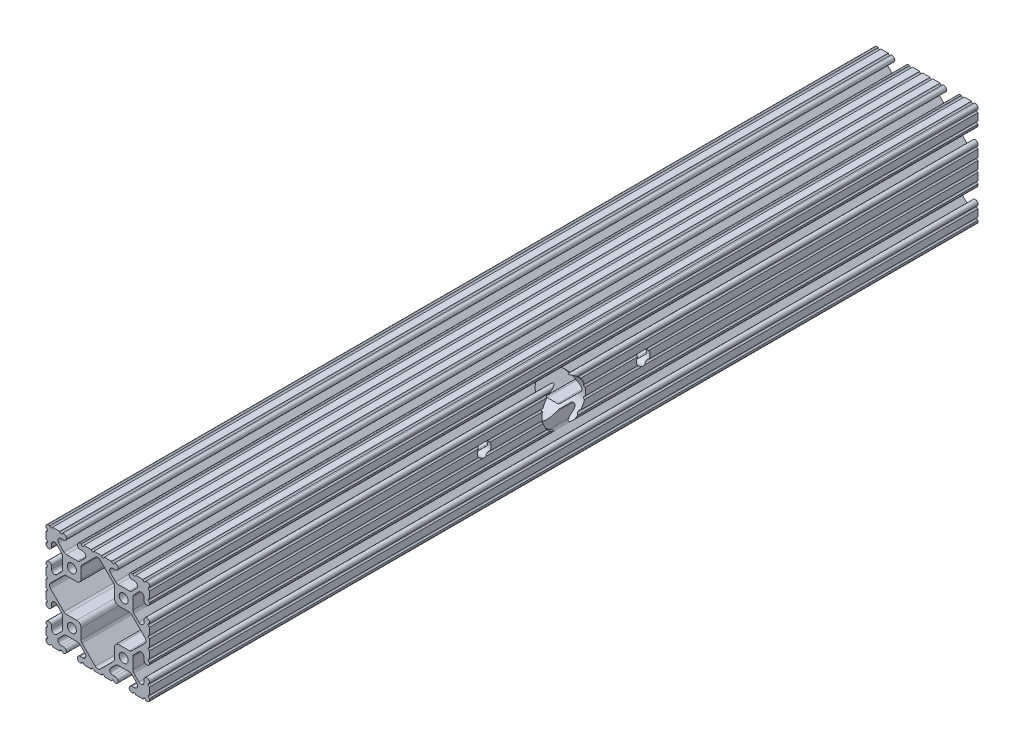
from build123d import *

# Parameters (mm, degrees)
SKETCH3_W               = 38.1
SKETCH3_H               = 38.1
BOSS_EXTRUDE1_DEPTH     = 304.8
SKETCH4_R               = 3.3274
CUT_EXTRUDE1_DEPTH      = 611.195022104
BODY_MOVE_COPY2_START   = -304.8
BODY_MOVE_COPY2_DEPTH   = 609.6
BODY_MOVE_COPY2_2_DEPTH = 609.6
MIRROR1_START           = -304.8
MIRROR1_OUTLINE_R       = 3.3274
MIRROR1_DEPTH           = 609.6
MIRROR5_START           = -304.8
MIRROR5_OUTLINE_R       = 3.3274
MIRROR5_DEPTH           = 609.6
CUT_EXTRUDE2_DEPTH      = 612.9766172
CUT_EXTRUDE3_DEPTH      = 612.9766172
DELETEFACE1_START       = -304.8
DELETEFACE1_DEPTH       = 609.6
FILLET1_R               = 2.54
FILLET2_R               = 1.778
SKETCH8_R               = 16
CUT_EXTRUDE5_DEPTH      = 317.482369177
SKETCH9_R               = 5
CUT_EXTRUDE6_DEPTH      = 317.482369298


# Read off the part's stored shape, not the designer's step: Body-Move/Copy2, Mirror1, Mirror5, DeleteFace1
with BuildPart() as part:
    # Sketch3 → Boss-Extrude1 (new, symmetric)
    with BuildSketch(Plane.XY):
        Rectangle(SKETCH3_W, SKETCH3_H)
    extrude(amount=BOSS_EXTRUDE1_DEPTH, both=True)

    # Sketch4 → Cut-Extrude1 (cut, through all)
    with BuildSketch(Plane.XY.offset(304.8)):
        with BuildLine():
            Line((4.064, 19.05), (-4.064, 19.05))
            Line((-4.064, 19.05), (-4.064, 14.986))
            Line((-4.064, 14.986), (-8.069205235, 14.986))
            ThreePointArc((-8.069205235, 14.986), (-10.118180426, 13.616918548), (-9.637422953, 11.199987518))
            Line((-9.637422953, 11.199987518), (-5.181135435, 6.7437))
            Line((-5.181135435, 6.7437), (5.181135435, 6.7437))
            Line((5.181135435, 6.7437), (9.637422953, 11.199987518))
            ThreePointArc((9.637422953, 11.199987518), (10.118180426, 13.616918548), (8.069205235, 14.986))
            Line((8.069205235, 14.986), (4.064, 14.986))
            Line((4.064, 14.986), (4.064, 19.05))
        make_face()
        with BuildLine():
            Line((19.05, -4.064), (19.05, 4.064))
            Line((19.05, 4.064), (14.986, 4.064))
            Line((14.986, 4.064), (14.986, 8.069205235))
            ThreePointArc((14.986, 8.069205235), (13.616918548, 10.118180426), (11.199987518, 9.637422953))
            Line((11.199987518, 9.637422953), (6.7437, 5.181135435))
            Line((6.7437, 5.181135435), (6.7437, -5.181135435))
            Line((6.7437, -5.181135435), (11.199987518, -9.637422953))
            ThreePointArc((11.199987518, -9.637422953), (13.616918548, -10.118180426), (14.986, -8.069205235))
            Line((14.986, -8.069205235), (14.986, -4.064))
            Line((14.986, -4.064), (19.05, -4.064))
        make_face()
        with BuildLine():
            Line((-4.064, -14.986), (-4.064, -19.05))
            Line((-4.064, -19.05), (4.064, -19.05))
            Line((4.064, -19.05), (4.064, -14.986))
            Line((4.064, -14.986), (8.069205235, -14.986))
            ThreePointArc((8.069205235, -14.986), (10.118180426, -13.616918548), (9.637422953, -11.199987518))
            Line((9.637422953, -11.199987518), (5.181135435, -6.7437))
            Line((5.181135435, -6.7437), (-5.181135435, -6.7437))
            Line((-5.181135435, -6.7437), (-9.637422953, -11.199987518))
            ThreePointArc((-9.637422953, -11.199987518), (-10.118180426, -13.616918548), (-8.069205235, -14.986))
            Line((-8.069205235, -14.986), (-4.064, -14.986))
        make_face()
        with BuildLine():
            Line((-14.986, 4.064), (-19.05, 4.064))
            Line((-19.05, 4.064), (-19.05, -4.064))
            Line((-19.05, -4.064), (-14.986, -4.064))
            Line((-14.986, -4.064), (-14.986, -8.069205235))
            ThreePointArc((-14.986, -8.069205235), (-13.616918548, -10.118180426), (-11.199987518, -9.637422953))
            Line((-11.199987518, -9.637422953), (-6.7437, -5.181135435))
            Line((-6.7437, -5.181135435), (-6.7437, 5.181135435))
            Line((-6.7437, 5.181135435), (-11.199987518, 9.637422953))
            ThreePointArc((-11.199987518, 9.637422953), (-13.616918548, 10.118180426), (-14.986, 8.069205235))
            Line((-14.986, 8.069205235), (-14.986, 4.064))
        make_face()
        Circle(SKETCH4_R)
    extrude(amount=-CUT_EXTRUDE1_DEPTH, mode=Mode.SUBTRACT)

    # Body-Move/Copy2 outline → Body-Move/Copy2 (cut)
    with BuildSketch(Plane.XY.offset(BODY_MOVE_COPY2_START)):
        with BuildLine():
            Line((-13.868864565, 12.3063), (-19.05, 12.3063))
            Line((-19.05, 12.3063), (-19.05, 4.064))
            Line((-19.05, 4.064), (-14.986, 4.064))
            Line((-14.986, 4.064), (-14.986, 8.069205235))
            ThreePointArc((-14.986, 8.069205235), (-13.616918548, 10.118180426), (-11.199987518, 9.637422953))
            Line((-11.199987518, 9.637422953), (-13.868864565, 12.3063))
        make_face()
        with BuildLine():
            Line((-19.05, 19.05), (-19.05, 15.7226))
            ThreePointArc((-19.05, 15.7226), (-16.697172896, 16.697172896), (-15.7226, 19.05))
            Line((-15.7226, 19.05), (-19.05, 19.05))
        make_face()
        with BuildLine():
            Line((-4.064, 19.05), (-12.3063, 19.05))
            Line((-12.3063, 19.05), (-12.3063, 13.868864565))
            Line((-12.3063, 13.868864565), (-9.637422953, 11.199987518))
            ThreePointArc((-9.637422953, 11.199987518), (-10.118180426, 13.616918548), (-8.069205235, 14.986))
            Line((-8.069205235, 14.986), (-4.064, 14.986))
            Line((-4.064, 14.986), (-4.064, 19.05))
        make_face()
        with BuildLine():
            Line((-3.3274, 0), (-6.7437, 0))
            Line((-6.7437, 0), (-6.7437, -5.181135435))
            Line((-6.7437, -5.181135435), (-11.199987518, -9.637422953))
            ThreePointArc((-11.199987518, -9.637422953), (-13.616918548, -10.118180426), (-14.986, -8.069205235))
            Line((-14.986, -8.069205235), (-14.986, -4.064))
            Line((-14.986, -4.064), (-19.05, -4.064))
            Line((-19.05, -4.064), (-19.05, -19.05))
            Line((-19.05, -19.05), (-4.064, -19.05))
            Line((-4.064, -19.05), (-4.064, -14.986))
            Line((-4.064, -14.986), (-8.069205235, -14.986))
            ThreePointArc((-8.069205235, -14.986), (-10.118180426, -13.616918548), (-9.637422953, -11.199987518))
            Line((-9.637422953, -11.199987518), (-5.181135435, -6.7437))
            Line((-5.181135435, -6.7437), (5.181135435, -6.7437))
            Line((5.181135435, -6.7437), (9.637422953, -11.199987518))
            ThreePointArc((9.637422953, -11.199987518), (10.118180426, -13.616918548), (8.069205235, -14.986))
            Line((8.069205235, -14.986), (4.064, -14.986))
            Line((4.064, -14.986), (4.064, -19.05))
            Line((4.064, -19.05), (19.05, -19.05))
            Line((19.05, -19.05), (19.05, -4.064))
            Line((19.05, -4.064), (14.986, -4.064))
            Line((14.986, -4.064), (14.986, -8.069205235))
            ThreePointArc((14.986, -8.069205235), (13.616918548, -10.118180426), (11.199987518, -9.637422953))
            Line((11.199987518, -9.637422953), (6.7437, -5.181135435))
            Line((6.7437, -5.181135435), (6.7437, 5.181135435))
            Line((6.7437, 5.181135435), (11.199987518, 9.637422953))
            ThreePointArc((11.199987518, 9.637422953), (13.616918548, 10.118180426), (14.986, 8.069205235))
            Line((14.986, 8.069205235), (14.986, 4.064))
            Line((14.986, 4.064), (19.05, 4.064))
            Line((19.05, 4.064), (19.05, 19.05))
            Line((19.05, 19.05), (4.064, 19.05))
            Line((4.064, 19.05), (4.064, 14.986))
            Line((4.064, 14.986), (8.069205235, 14.986))
            ThreePointArc((8.069205235, 14.986), (10.118180426, 13.616918548), (9.637422953, 11.199987518))
            Line((9.637422953, 11.199987518), (5.181135435, 6.7437))
            Line((5.181135435, 6.7437), (0, 6.7437))
            Line((0, 6.7437), (0, 3.3274))
            ThreePointArc((0, 3.3274), (2.352827104, -2.352827104), (-3.3274, 0))
        make_face()
    extrude(amount=BODY_MOVE_COPY2_DEPTH, mode=Mode.SUBTRACT)

    # Body-Move_Copy2 2 outline → Body-Move_Copy2 2 (add)
    with BuildSketch(Plane.XY.offset(BODY_MOVE_COPY2_START)):
        with BuildLine():
            Line((-38.1, 38.1), (-38.1, 23.114))
            Line((-38.1, 23.114), (-34.036, 23.114))
            Line((-34.036, 23.114), (-34.036, 27.119205235))
            ThreePointArc((-34.036, 27.119205235), (-32.666918548, 29.168180426), (-30.249987518, 28.687422953))
            Line((-30.249987518, 28.687422953), (-25.7937, 24.231135435))
            Line((-25.7937, 24.231135435), (-25.7937, 13.868864565))
            Line((-25.7937, 13.868864565), (-30.249987518, 9.412577047))
            ThreePointArc((-30.249987518, 9.412577047), (-32.666918548, 8.931819574), (-34.036, 10.980794765))
            Line((-34.036, 10.980794765), (-34.036, 14.986))
            Line((-34.036, 14.986), (-38.1, 14.986))
            Line((-38.1, 14.986), (-38.1, 0))
            Line((-38.1, 0), (-23.114, 0))
            Line((-23.114, 0), (-23.114, 4.064))
            Line((-23.114, 4.064), (-27.119205235, 4.064))
            ThreePointArc((-27.119205235, 4.064), (-29.168180426, 5.433081452), (-28.687422953, 7.850012482))
            Line((-28.687422953, 7.850012482), (-24.231135435, 12.3063))
            Line((-24.231135435, 12.3063), (-19.05, 12.3063))
            Line((-19.05, 12.3063), (-19.05, 15.7226))
            ThreePointArc((-19.05, 15.7226), (-21.402827104, 21.402827104), (-15.7226, 19.05))
            Line((-15.7226, 19.05), (-12.3063, 19.05))
            Line((-12.3063, 19.05), (-12.3063, 24.231135435))
            Line((-12.3063, 24.231135435), (-7.850012482, 28.687422953))
            ThreePointArc((-7.850012482, 28.687422953), (-5.433081452, 29.168180426), (-4.064, 27.119205235))
            Line((-4.064, 27.119205235), (-4.064, 23.114))
            Line((-4.064, 23.114), (0, 23.114))
            Line((0, 23.114), (0, 38.1))
            Line((0, 38.1), (-14.986, 38.1))
            Line((-14.986, 38.1), (-14.986, 34.036))
            Line((-14.986, 34.036), (-10.980794765, 34.036))
            ThreePointArc((-10.980794765, 34.036), (-8.931819574, 32.666918548), (-9.412577047, 30.249987518))
            Line((-9.412577047, 30.249987518), (-13.868864565, 25.7937))
            Line((-13.868864565, 25.7937), (-24.231135435, 25.7937))
            Line((-24.231135435, 25.7937), (-28.687422953, 30.249987518))
            ThreePointArc((-28.687422953, 30.249987518), (-29.168180426, 32.666918548), (-27.119205235, 34.036))
            Line((-27.119205235, 34.036), (-23.114, 34.036))
            Line((-23.114, 34.036), (-23.114, 38.1))
            Line((-23.114, 38.1), (-38.1, 38.1))
        make_face()
        with BuildLine():
            Line((-10.980794765, 4.064), (-14.986, 4.064))
            Line((-14.986, 4.064), (-14.986, 0))
            Line((-14.986, 0), (-6.7437, 0))
            Line((-6.7437, 0), (-6.7437, 5.181135435))
            Line((-6.7437, 5.181135435), (-9.412577047, 7.850012482))
            ThreePointArc((-9.412577047, 7.850012482), (-8.931819574, 5.433081452), (-10.980794765, 4.064))
        make_face()
        with BuildLine():
            Line((0, 14.986), (-4.064, 14.986))
            Line((-4.064, 14.986), (-4.064, 10.980794765))
            ThreePointArc((-4.064, 10.980794765), (-5.433081452, 8.931819574), (-7.850012482, 9.412577047))
            Line((-7.850012482, 9.412577047), (-5.181135435, 6.7437))
            Line((-5.181135435, 6.7437), (0, 6.7437))
            Line((0, 6.7437), (0, 14.986))
        make_face()
        with BuildLine():
            ThreePointArc((0, 3.3274), (-2.352827104, 2.352827104), (-3.3274, 0))
            Line((-3.3274, 0), (0, 0))
            Line((0, 0), (0, 3.3274))
        make_face()
    extrude(amount=BODY_MOVE_COPY2_2_DEPTH)

    # Mirror1 outline → Mirror1 (add)
    with BuildSketch(Plane.XY.offset(MIRROR1_START)):
        with BuildLine():
            Line((-38.1, 0), (-38.1, -14.986))
            Line((-38.1, -14.986), (-34.036, -14.986))
            Line((-34.036, -14.986), (-34.036, -10.980794765))
            ThreePointArc((-34.036, -10.980794765), (-32.666918548, -8.931819574), (-30.249987518, -9.412577047))
            Line((-30.249987518, -9.412577047), (-25.7937, -13.868864565))
            Line((-25.7937, -13.868864565), (-25.7937, -24.231135435))
            Line((-25.7937, -24.231135435), (-30.249987518, -28.687422953))
            ThreePointArc((-30.249987518, -28.687422953), (-32.666918548, -29.168180426), (-34.036, -27.119205235))
            Line((-34.036, -27.119205235), (-34.036, -23.114))
            Line((-34.036, -23.114), (-38.1, -23.114))
            Line((-38.1, -23.114), (-38.1, -38.1))
            Line((-38.1, -38.1), (-23.114, -38.1))
            Line((-23.114, -38.1), (-23.114, -34.036))
            Line((-23.114, -34.036), (-27.119205235, -34.036))
            ThreePointArc((-27.119205235, -34.036), (-29.168180426, -32.666918548), (-28.687422953, -30.249987518))
            Line((-28.687422953, -30.249987518), (-24.231135435, -25.7937))
            Line((-24.231135435, -25.7937), (-13.868864565, -25.7937))
            Line((-13.868864565, -25.7937), (-9.412577047, -30.249987518))
            ThreePointArc((-9.412577047, -30.249987518), (-8.931819574, -32.666918548), (-10.980794765, -34.036))
            Line((-10.980794765, -34.036), (-14.986, -34.036))
            Line((-14.986, -34.036), (-14.986, -38.1))
            Line((-14.986, -38.1), (0, -38.1))
            Line((0, -38.1), (0, -23.114))
            Line((0, -23.114), (-4.064, -23.114))
            Line((-4.064, -23.114), (-4.064, -27.119205235))
            ThreePointArc((-4.064, -27.119205235), (-5.433081452, -29.168180426), (-7.850012482, -28.687422953))
            Line((-7.850012482, -28.687422953), (-12.3063, -24.231135435))
            Line((-12.3063, -24.231135435), (-12.3063, -13.868864565))
            Line((-12.3063, -13.868864565), (-7.850012482, -9.412577047))
            ThreePointArc((-7.850012482, -9.412577047), (-5.433081452, -8.931819574), (-4.064, -10.980794765))
            Line((-4.064, -10.980794765), (-4.064, -14.986))
            Line((-4.064, -14.986), (0, -14.986))
            Line((0, -14.986), (0, 0))
            Line((0, 0), (-14.986, 0))
            Line((-14.986, 0), (-14.986, -4.064))
            Line((-14.986, -4.064), (-10.980794765, -4.064))
            ThreePointArc((-10.980794765, -4.064), (-8.931819574, -5.433081452), (-9.412577047, -7.850012482))
            Line((-9.412577047, -7.850012482), (-13.868864565, -12.3063))
            Line((-13.868864565, -12.3063), (-24.231135435, -12.3063))
            Line((-24.231135435, -12.3063), (-28.687422953, -7.850012482))
            ThreePointArc((-28.687422953, -7.850012482), (-29.168180426, -5.433081452), (-27.119205235, -4.064))
            Line((-27.119205235, -4.064), (-23.114, -4.064))
            Line((-23.114, -4.064), (-23.114, 0))
            Line((-23.114, 0), (-38.1, 0))
        make_face()
        with Locations((-19.05, -19.05)):
            Circle(MIRROR1_OUTLINE_R, mode=Mode.SUBTRACT)
    extrude(amount=MIRROR1_DEPTH)

    # Mirror5 outline → Mirror5 (add)
    with BuildSketch(Plane.XY.offset(MIRROR5_START)):
        with BuildLine():
            Line((14.986, 38.1), (0, 38.1))
            Line((0, 38.1), (0, 23.114))
            Line((0, 23.114), (4.064, 23.114))
            Line((4.064, 23.114), (4.064, 27.119205235))
            ThreePointArc((4.064, 27.119205235), (5.433081452, 29.168180426), (7.850012482, 28.687422953))
            Line((7.850012482, 28.687422953), (12.3063, 24.231135435))
            Line((12.3063, 24.231135435), (12.3063, 13.868864565))
            Line((12.3063, 13.868864565), (7.850012482, 9.412577047))
            ThreePointArc((7.850012482, 9.412577047), (5.433081452, 8.931819574), (4.064, 10.980794765))
            Line((4.064, 10.980794765), (4.064, 14.986))
            Line((4.064, 14.986), (0, 14.986))
            Line((0, 14.986), (0, -14.986))
            Line((0, -14.986), (4.064, -14.986))
            Line((4.064, -14.986), (4.064, -10.980794765))
            ThreePointArc((4.064, -10.980794765), (5.433081452, -8.931819574), (7.850012482, -9.412577047))
            Line((7.850012482, -9.412577047), (12.3063, -13.868864565))
            Line((12.3063, -13.868864565), (12.3063, -24.231135435))
            Line((12.3063, -24.231135435), (7.850012482, -28.687422953))
            ThreePointArc((7.850012482, -28.687422953), (5.433081452, -29.168180426), (4.064, -27.119205235))
            Line((4.064, -27.119205235), (4.064, -23.114))
            Line((4.064, -23.114), (0, -23.114))
            Line((0, -23.114), (0, -38.1))
            Line((0, -38.1), (14.986, -38.1))
            Line((14.986, -38.1), (14.986, -34.036))
            Line((14.986, -34.036), (10.980794765, -34.036))
            ThreePointArc((10.980794765, -34.036), (8.931819574, -32.666918548), (9.412577047, -30.249987518))
            Line((9.412577047, -30.249987518), (13.868864565, -25.7937))
            Line((13.868864565, -25.7937), (24.231135435, -25.7937))
            Line((24.231135435, -25.7937), (28.687422953, -30.249987518))
            ThreePointArc((28.687422953, -30.249987518), (29.168180426, -32.666918548), (27.119205235, -34.036))
            Line((27.119205235, -34.036), (23.114, -34.036))
            Line((23.114, -34.036), (23.114, -38.1))
            Line((23.114, -38.1), (38.1, -38.1))
            Line((38.1, -38.1), (38.1, -23.114))
            Line((38.1, -23.114), (34.036, -23.114))
            Line((34.036, -23.114), (34.036, -27.119205235))
            ThreePointArc((34.036, -27.119205235), (32.666918548, -29.168180426), (30.249987518, -28.687422953))
            Line((30.249987518, -28.687422953), (25.7937, -24.231135435))
            Line((25.7937, -24.231135435), (25.7937, -13.868864565))
            Line((25.7937, -13.868864565), (30.249987518, -9.412577047))
            ThreePointArc((30.249987518, -9.412577047), (32.666918548, -8.931819574), (34.036, -10.980794765))
            Line((34.036, -10.980794765), (34.036, -14.986))
            Line((34.036, -14.986), (38.1, -14.986))
            Line((38.1, -14.986), (38.1, 14.986))
            Line((38.1, 14.986), (34.036, 14.986))
            Line((34.036, 14.986), (34.036, 10.980794765))
            ThreePointArc((34.036, 10.980794765), (32.666918548, 8.931819574), (30.249987518, 9.412577047))
            Line((30.249987518, 9.412577047), (25.7937, 13.868864565))
            Line((25.7937, 13.868864565), (25.7937, 24.231135435))
            Line((25.7937, 24.231135435), (30.249987518, 28.687422953))
            ThreePointArc((30.249987518, 28.687422953), (32.666918548, 29.168180426), (34.036, 27.119205235))
            Line((34.036, 27.119205235), (34.036, 23.114))
            Line((34.036, 23.114), (38.1, 23.114))
            Line((38.1, 23.114), (38.1, 38.1))
            Line((38.1, 38.1), (23.114, 38.1))
            Line((23.114, 38.1), (23.114, 34.036))
            Line((23.114, 34.036), (27.119205235, 34.036))
            ThreePointArc((27.119205235, 34.036), (29.168180426, 32.666918548), (28.687422953, 30.249987518))
            Line((28.687422953, 30.249987518), (24.231135435, 25.7937))
            Line((24.231135435, 25.7937), (13.868864565, 25.7937))
            Line((13.868864565, 25.7937), (9.412577047, 30.249987518))
            ThreePointArc((9.412577047, 30.249987518), (8.931819574, 32.666918548), (10.980794765, 34.036))
            Line((10.980794765, 34.036), (14.986, 34.036))
            Line((14.986, 34.036), (14.986, 38.1))
        make_face()
        with Locations((19.05, -19.05)):
            Circle(MIRROR5_OUTLINE_R, mode=Mode.SUBTRACT)
        with BuildLine():
            Line((13.868864565, -12.3063), (9.412577047, -7.850012482))
            ThreePointArc((9.412577047, -7.850012482), (8.931819574, -5.433081452), (10.980794765, -4.064))
            Line((10.980794765, -4.064), (14.986, -4.064))
            Line((14.986, -4.064), (14.986, 4.064))
            Line((14.986, 4.064), (10.980794765, 4.064))
            ThreePointArc((10.980794765, 4.064), (8.931819574, 5.433081452), (9.412577047, 7.850012482))
            Line((9.412577047, 7.850012482), (13.868864565, 12.3063))
            Line((13.868864565, 12.3063), (24.231135435, 12.3063))
            Line((24.231135435, 12.3063), (28.687422953, 7.850012482))
            ThreePointArc((28.687422953, 7.850012482), (29.168180426, 5.433081452), (27.119205235, 4.064))
            Line((27.119205235, 4.064), (23.114, 4.064))
            Line((23.114, 4.064), (23.114, -4.064))
            Line((23.114, -4.064), (27.119205235, -4.064))
            ThreePointArc((27.119205235, -4.064), (29.168180426, -5.433081452), (28.687422953, -7.850012482))
            Line((28.687422953, -7.850012482), (24.231135435, -12.3063))
            Line((24.231135435, -12.3063), (13.868864565, -12.3063))
        make_face(mode=Mode.SUBTRACT)
        with Locations((19.05, 19.05)):
            Circle(MIRROR5_OUTLINE_R, mode=Mode.SUBTRACT)
    extrude(amount=MIRROR5_DEPTH)

    # Sketch5 → Cut-Extrude2 (cut, through all)
    with BuildSketch(Plane.XY.offset(304.8)):
        with BuildLine():
            Line((-38.1, 35.306), (-38.1, 33.274))
            ThreePointArc((-38.1, 33.274), (-37.084, 34.29), (-38.1, 35.306))
        make_face()
        with BuildLine():
            Line((-35.306, 38.1), (-33.274, 38.1))
            ThreePointArc((-33.274, 38.1), (-34.29, 37.084), (-35.306, 38.1))
        make_face()
        with BuildLine():
            Line((-27.94, 38.1), (-25.908, 38.1))
            ThreePointArc((-25.908, 38.1), (-26.924, 37.084), (-27.94, 38.1))
        make_face()
        with BuildLine():
            Line((-23.114, 38.1), (-25.146, 38.1))
            ThreePointArc((-25.146, 38.1), (-23.709159021, 37.504840979), (-23.114, 36.068))
            Line((-23.114, 36.068), (-23.114, 38.1))
        make_face()
        with BuildLine():
            Line((-23.114, 34.036), (-23.114, 36.068))
            ThreePointArc((-23.114, 36.068), (-23.709159021, 34.631159021), (-25.146, 34.036))
            Line((-25.146, 34.036), (-23.114, 34.036))
        make_face()
        with BuildLine():
            Line((-38.1, 25.146), (-38.1, 23.114))
            Line((-38.1, 23.114), (-36.068, 23.114))
            ThreePointArc((-36.068, 23.114), (-37.504840979, 23.709159021), (-38.1, 25.146))
        make_face()
        with BuildLine():
            ThreePointArc((-34.036, 25.146), (-34.631159021, 23.709159021), (-36.068, 23.114))
            Line((-36.068, 23.114), (-34.036, 23.114))
            Line((-34.036, 23.114), (-34.036, 25.146))
        make_face()
        with BuildLine():
            Line((-12.954, 38.1), (-14.986, 38.1))
            Line((-14.986, 38.1), (-14.986, 36.068))
            ThreePointArc((-14.986, 36.068), (-14.390840979, 37.504840979), (-12.954, 38.1))
        make_face()
        with BuildLine():
            ThreePointArc((-12.954, 34.036), (-14.390840979, 34.631159021), (-14.986, 36.068))
            Line((-14.986, 36.068), (-14.986, 34.036))
            Line((-14.986, 34.036), (-12.954, 34.036))
        make_face()
        with BuildLine():
            ThreePointArc((-10.16, 38.1), (-11.176, 37.084), (-12.192, 38.1))
            Line((-12.192, 38.1), (-10.16, 38.1))
        make_face()
        with BuildLine():
            ThreePointArc((-2.794, 38.1), (-3.81, 37.084), (-4.826, 38.1))
            Line((-4.826, 38.1), (-2.794, 38.1))
        make_face()
        with BuildLine():
            ThreePointArc((-38.1, 27.94), (-37.084, 26.924), (-38.1, 25.908))
            Line((-38.1, 25.908), (-38.1, 27.94))
        make_face()
        with BuildLine():
            Line((10.16, 38.1), (12.192, 38.1))
            ThreePointArc((12.192, 38.1), (11.176, 37.084), (10.16, 38.1))
        make_face()
        with BuildLine():
            ThreePointArc((12.954, 38.1), (14.390840979, 37.504840979), (14.986, 36.068))
            Line((14.986, 36.068), (14.986, 38.1))
            Line((14.986, 38.1), (12.954, 38.1))
        make_face()
        with BuildLine():
            Line((12.954, 34.036), (14.986, 34.036))
            Line((14.986, 34.036), (14.986, 36.068))
            ThreePointArc((14.986, 36.068), (14.390840979, 34.631159021), (12.954, 34.036))
        make_face()
        with BuildLine():
            ThreePointArc((4.826, 38.1), (3.81, 37.084), (2.794, 38.1))
            Line((2.794, 38.1), (4.826, 38.1))
        make_face()
        with BuildLine():
            Line((25.146, 38.1), (23.114, 38.1))
            Line((23.114, 38.1), (23.114, 36.068000019))
            ThreePointArc((23.114, 36.068000019), (23.709159028, 37.504840986), (25.146, 38.1))
        make_face()
        with BuildLine():
            ThreePointArc((25.146, 34.036), (23.709159014, 34.631159028), (23.114, 36.068000019))
            Line((23.114, 36.068000019), (23.114, 34.036))
            Line((23.114, 34.036), (25.146, 34.036))
        make_face()
        with BuildLine():
            ThreePointArc((27.94, 38.1), (26.924, 37.084), (25.908, 38.1))
            Line((25.908, 38.1), (27.94, 38.1))
        make_face()
        with BuildLine():
            Line((35.306, 38.1), (33.274, 38.1))
            ThreePointArc((33.274, 38.1), (34.29, 37.084), (35.306, 38.1))
        make_face()
        with BuildLine():
            Line((38.1, 35.306), (38.1, 33.274))
            ThreePointArc((38.1, 33.274), (37.084, 34.29), (38.1, 35.306))
        make_face()
        with BuildLine():
            Line((38.1, 27.94), (38.1, 25.908))
            ThreePointArc((38.1, 25.908), (37.084, 26.924), (38.1, 27.94))
        make_face()
        with BuildLine():
            Line((34.036, 23.114), (36.068, 23.114))
            ThreePointArc((36.068, 23.114), (34.631159021, 23.709159021), (34.036, 25.146))
            Line((34.036, 25.146), (34.036, 23.114))
        make_face()
        with BuildLine():
            Line((38.1, 23.114), (38.1, 25.146))
            ThreePointArc((38.1, 25.146), (37.504840979, 23.709159021), (36.068, 23.114))
            Line((36.068, 23.114), (38.1, 23.114))
        make_face()
        with BuildLine():
            ThreePointArc((34.036, 12.954), (34.631159021, 14.390840979), (36.068, 14.986))
            Line((36.068, 14.986), (34.036, 14.986))
            Line((34.036, 14.986), (34.036, 12.954))
        make_face()
        with BuildLine():
            Line((38.1, 12.954), (38.1, 14.986))
            Line((38.1, 14.986), (36.068, 14.986))
            ThreePointArc((36.068, 14.986), (37.504840979, 14.390840979), (38.1, 12.954))
        make_face()
        with BuildLine():
            ThreePointArc((38.1, 10.16), (37.084, 11.176), (38.1, 12.192))
            Line((38.1, 12.192), (38.1, 10.16))
        make_face()
        with BuildLine():
            ThreePointArc((38.1, 2.794), (37.084, 3.81), (38.1, 4.826))
            Line((38.1, 4.826), (38.1, 2.794))
        make_face()
        with BuildLine():
            ThreePointArc((38.1, -4.826), (37.084, -3.81), (38.1, -2.794))
            Line((38.1, -2.794), (38.1, -4.826))
        make_face()
        with BuildLine():
            Line((38.1, -10.16), (38.1, -12.192))
            ThreePointArc((38.1, -12.192), (37.084, -11.176), (38.1, -10.16))
        make_face()
        with BuildLine():
            Line((34.036, -12.954), (34.036, -14.986))
            Line((34.036, -14.986), (36.068, -14.986))
            ThreePointArc((36.068, -14.986), (34.631159021, -14.390840979), (34.036, -12.954))
        make_face()
        with BuildLine():
            ThreePointArc((38.1, -12.954), (37.504840979, -14.390840979), (36.068, -14.986))
            Line((36.068, -14.986), (38.1, -14.986))
            Line((38.1, -14.986), (38.1, -12.954))
        make_face()
        with BuildLine():
            ThreePointArc((34.036, -25.146), (34.631159021, -23.709159021), (36.068, -23.114))
            Line((36.068, -23.114), (34.036, -23.114))
            Line((34.036, -23.114), (34.036, -25.146))
        make_face()
        with BuildLine():
            Line((38.1, -25.146), (38.1, -23.114))
            Line((38.1, -23.114), (36.068, -23.114))
            ThreePointArc((36.068, -23.114), (37.504840979, -23.709159021), (38.1, -25.146))
        make_face()
        with BuildLine():
            ThreePointArc((38.1, -27.94), (37.084, -26.924), (38.1, -25.908))
            Line((38.1, -25.908), (38.1, -27.94))
        make_face()
        with BuildLine():
            Line((23.114, -34.036), (23.114, -36.068))
            ThreePointArc((23.114, -36.068), (23.709159021, -34.631159021), (25.146, -34.036))
            Line((25.146, -34.036), (23.114, -34.036))
        make_face()
        with BuildLine():
            Line((23.114, -38.1), (25.146, -38.1))
            ThreePointArc((25.146, -38.1), (23.709159021, -37.504840979), (23.114, -36.068))
            Line((23.114, -36.068), (23.114, -38.1))
        make_face()
        with BuildLine():
            Line((27.94, -38.1), (25.908, -38.1))
            ThreePointArc((25.908, -38.1), (26.924, -37.084), (27.94, -38.1))
        make_face()
        with BuildLine():
            Line((35.306, -38.1), (33.274, -38.1))
            ThreePointArc((33.274, -38.1), (34.29, -37.084), (35.306, -38.1))
        make_face()
        with BuildLine():
            Line((38.1, -35.306), (38.1, -33.274))
            ThreePointArc((38.1, -33.274), (37.084, -34.29), (38.1, -35.306))
        make_face()
        with BuildLine():
            Line((-12.954, -34.036), (-14.986, -34.036))
            Line((-14.986, -34.036), (-14.986, -36.068))
            ThreePointArc((-14.986, -36.068), (-14.390840979, -34.631159021), (-12.954, -34.036))
        make_face()
        with BuildLine():
            ThreePointArc((-12.954, -38.1), (-14.390840979, -37.504840979), (-14.986, -36.068))
            Line((-14.986, -36.068), (-14.986, -38.1))
            Line((-14.986, -38.1), (-12.954, -38.1))
        make_face()
        with BuildLine():
            Line((-10.16, -38.1), (-12.192, -38.1))
            ThreePointArc((-12.192, -38.1), (-11.176, -37.084), (-10.16, -38.1))
        make_face()
        with BuildLine():
            ThreePointArc((-4.826, -38.1), (-3.81, -37.084), (-2.794, -38.1))
            Line((-2.794, -38.1), (-4.826, -38.1))
        make_face()
        with BuildLine():
            ThreePointArc((2.794, -38.1), (3.81, -37.084), (4.826, -38.1))
            Line((4.826, -38.1), (2.794, -38.1))
        make_face()
        with BuildLine():
            ThreePointArc((10.16, -38.1), (11.176, -37.084), (12.192, -38.1))
            Line((12.192, -38.1), (10.16, -38.1))
        make_face()
        with BuildLine():
            ThreePointArc((12.954, -34.036), (14.390840979, -34.631159021), (14.986, -36.068))
            Line((14.986, -36.068), (14.986, -34.036))
            Line((14.986, -34.036), (12.954, -34.036))
        make_face()
        with BuildLine():
            Line((12.954, -38.1), (14.986, -38.1))
            Line((14.986, -38.1), (14.986, -36.068))
            ThreePointArc((14.986, -36.068), (14.390840979, -37.504840979), (12.954, -38.1))
        make_face()
        with BuildLine():
            Line((-38.1, -23.114), (-38.1, -25.146))
            ThreePointArc((-38.1, -25.146), (-37.504840979, -23.709159021), (-36.068, -23.114))
            Line((-36.068, -23.114), (-38.1, -23.114))
        make_face()
        with BuildLine():
            Line((-34.036, -23.114), (-36.068, -23.114))
            ThreePointArc((-36.068, -23.114), (-34.631159021, -23.709159021), (-34.036, -25.146))
            Line((-34.036, -25.146), (-34.036, -23.114))
        make_face()
        with BuildLine():
            Line((-38.1, -27.94), (-38.1, -25.908))
            ThreePointArc((-38.1, -25.908), (-37.084, -26.924), (-38.1, -27.94))
        make_face()
        with BuildLine():
            Line((-38.1, -35.306), (-38.1, -33.274))
            ThreePointArc((-38.1, -33.274), (-37.084, -34.29), (-38.1, -35.306))
        make_face()
        with BuildLine():
            Line((-35.306, -38.1), (-33.274, -38.1))
            ThreePointArc((-33.274, -38.1), (-34.29, -37.084), (-35.306, -38.1))
        make_face()
        with BuildLine():
            ThreePointArc((-27.94, -38.1), (-26.924, -37.084), (-25.908, -38.1))
            Line((-25.908, -38.1), (-27.94, -38.1))
        make_face()
        with BuildLine():
            ThreePointArc((-25.146, -34.036), (-23.709159021, -34.631159021), (-23.114, -36.068))
            Line((-23.114, -36.068), (-23.114, -34.036))
            Line((-23.114, -34.036), (-25.146, -34.036))
        make_face()
        with BuildLine():
            Line((-25.146, -38.1), (-23.114, -38.1))
            Line((-23.114, -38.1), (-23.114, -36.068))
            ThreePointArc((-23.114, -36.068), (-23.709159021, -37.504840979), (-25.146, -38.1))
        make_face()
        with BuildLine():
            Line((-38.1, -12.954), (-38.1, -14.986))
            Line((-38.1, -14.986), (-36.067999969, -14.986))
            ThreePointArc((-36.067999969, -14.986), (-37.504840968, -14.390840991), (-38.1, -12.954))
        make_face()
        with BuildLine():
            ThreePointArc((-34.036, -12.954), (-34.631159009, -14.390840968), (-36.067999969, -14.986))
            Line((-36.067999969, -14.986), (-34.036, -14.986))
            Line((-34.036, -14.986), (-34.036, -12.954))
        make_face()
        with BuildLine():
            ThreePointArc((-38.1, -10.16), (-37.084, -11.176), (-38.1, -12.192))
            Line((-38.1, -12.192), (-38.1, -10.16))
        make_face()
        with BuildLine():
            ThreePointArc((-38.1, -2.794), (-37.084, -3.81), (-38.1, -4.826))
            Line((-38.1, -4.826), (-38.1, -2.794))
        make_face()
        with BuildLine():
            ThreePointArc((-38.1, 4.826), (-37.084, 3.81), (-38.1, 2.794))
            Line((-38.1, 2.794), (-38.1, 4.826))
        make_face()
        with BuildLine():
            ThreePointArc((-38.1, 12.954), (-37.504840979, 14.390840979), (-36.068, 14.986))
            Line((-36.068, 14.986), (-38.1, 14.986))
            Line((-38.1, 14.986), (-38.1, 12.954))
        make_face()
        with BuildLine():
            Line((-38.1, 10.16), (-38.1, 12.192))
            ThreePointArc((-38.1, 12.192), (-37.084, 11.176), (-38.1, 10.16))
        make_face()
        with BuildLine():
            Line((-34.036, 12.954), (-34.036, 14.986))
            Line((-34.036, 14.986), (-36.068, 14.986))
            ThreePointArc((-36.068, 14.986), (-34.631159021, 14.390840979), (-34.036, 12.954))
        make_face()
    extrude(amount=-CUT_EXTRUDE2_DEPTH, mode=Mode.SUBTRACT)

    # Sketch6 → Cut-Extrude3 (cut, through all)
    with BuildSketch(Plane.XY.offset(304.8)):
        with BuildLine():
            Line((-35.804781959, 0.732653476), (-24.231135435, 12.3063))
            Line((-24.231135435, 12.3063), (-15.514219195, 12.3063))
            ThreePointArc((-15.514219195, 12.3063), (-13.245877779, 13.245877779), (-12.3063, 15.514219195))
            Line((-12.3063, 15.514219195), (-12.3063, 24.231135435))
            Line((-12.3063, 24.231135435), (-0.732653476, 35.804781959))
            ThreePointArc((-0.732653476, 35.804781959), (0, 36.108256965), (0.732653476, 35.804781959))
            Line((0.732653476, 35.804781959), (12.3063, 24.231135435))
            Line((12.3063, 24.231135435), (12.3063, 15.514219195))
            ThreePointArc((12.3063, 15.514219195), (13.245877779, 13.245877779), (15.514219195, 12.3063))
            Line((15.514219195, 12.3063), (24.231135435, 12.3063))
            Line((24.231135435, 12.3063), (35.804781959, 0.732653476))
            ThreePointArc((35.804781959, 0.732653476), (36.108256965, 0), (35.804781959, -0.732653476))
            Line((35.804781959, -0.732653476), (24.231135435, -12.3063))
            Line((24.231135435, -12.3063), (15.514219195, -12.3063))
            ThreePointArc((15.514219195, -12.3063), (13.245877779, -13.245877779), (12.3063, -15.514219195))
            Line((12.3063, -15.514219195), (12.3063, -24.231135435))
            Line((12.3063, -24.231135435), (0.732653476, -35.804781959))
            ThreePointArc((0.732653476, -35.804781959), (0, -36.108256965), (-0.732653476, -35.804781959))
            Line((-0.732653476, -35.804781959), (-12.3063, -24.231135435))
            Line((-12.3063, -24.231135435), (-12.3063, -15.514219195))
            ThreePointArc((-12.3063, -15.514219195), (-13.245877779, -13.245877779), (-15.514219195, -12.3063))
            Line((-15.514219195, -12.3063), (-24.231135435, -12.3063))
            Line((-24.231135435, -12.3063), (-35.804781959, -0.732653476))
            ThreePointArc((-35.804781959, -0.732653476), (-36.108256965, 0), (-35.804781959, 0.732653476))
        make_face()
    extrude(amount=-CUT_EXTRUDE3_DEPTH, mode=Mode.SUBTRACT)

    # DeleteFace1 outline → DeleteFace1 (cut)
    with BuildSketch(Plane.XY.offset(DELETEFACE1_START)):
        with BuildLine():
            ThreePointArc((35.804781959, 0.732653476), (36.108256965, 0), (35.804781959, -0.732653476))
            Line((35.804781959, -0.732653476), (36.537435435, 0))
            Line((36.537435435, 0), (35.804781959, 0.732653476))
        make_face()
        with BuildLine():
            ThreePointArc((0.732653476, -35.804781959), (0, -36.108256965), (-0.732653476, -35.804781959))
            Line((-0.732653476, -35.804781959), (0, -36.537435435))
            Line((0, -36.537435435), (0.732653476, -35.804781959))
        make_face()
        with BuildLine():
            ThreePointArc((-0.732653476, 35.804781959), (0, 36.108256965), (0.732653476, 35.804781959))
            Line((0.732653476, 35.804781959), (0, 36.537435435))
            Line((0, 36.537435435), (-0.732653476, 35.804781959))
        make_face()
        with BuildLine():
            ThreePointArc((-35.804781959, -0.732653476), (-36.108256965, 0), (-35.804781959, 0.732653476))
            Line((-35.804781959, 0.732653476), (-36.537435435, 0))
            Line((-36.537435435, 0), (-35.804781959, -0.732653476))
        make_face()
    extrude(amount=DELETEFACE1_DEPTH, mode=Mode.SUBTRACT)

    # Fillet1
    fillet1_edges = [part.edges().sort_by_distance(p)[0] for p in [
        (-13.868864565, 25.7937, 0),
        (-24.231135435, 25.7937, 0),
        (0, -36.537435435, 0),
        (36.537435435, 0, 0),
        (0, 36.537435435, 0),
        (-36.537435435, 0, 0),
        (-13.868864565, -25.7937, 0),
        (-24.231135435, -25.7937, 0),
        (-25.7937, -24.231135435, 0),
        (-25.7937, -13.868864565, 0),
        (-12.3063, -24.231135435, 0),
        (-24.231135435, -12.3063, 0),
        (13.868864565, 25.7937, 0),
        (24.231135435, 25.7937, 0),
        (25.7937, 24.231135435, 0),
        (25.7937, 13.868864565, 0),
        (12.3063, 24.231135435, 0),
        (24.231135435, 12.3063, 0),
        (13.868864565, -25.7937, 0),
        (24.231135435, -25.7937, 0),
        (25.7937, -24.231135435, 0),
        (25.7937, -13.868864565, 0),
        (12.3063, -24.231135435, 0),
        (24.231135435, -12.3063, 0),
        (-24.231135435, 12.3063, 0),
        (-12.3063, 24.231135435, 0),
        (-25.7937, 24.231135435, 0),
        (-25.7937, 13.868864565, 0),
    ]]
    fillet(fillet1_edges, radius=FILLET1_R)

    # Fillet2
    fillet2_edges = [part.edges().sort_by_distance(p)[0] for p in [
        (-38.1, -38.1, 0),
        (38.1, 38.1, 0),
        (38.1, -38.1, 0),
        (-38.1, 38.1, 0),
    ]]
    fillet(fillet2_edges, radius=FILLET2_R)

    # Sketch8 → Cut-Extrude5 (cut, through all)
    with BuildSketch(Plane(origin=(38.1, 0, 0), x_dir=(0, 0, -1), z_dir=(1, 0, 0))):
        with Locations(Location((0, 0, 0), (0, 0, 353.554780876))):
            Circle(SKETCH8_R)
    extrude(amount=-CUT_EXTRUDE5_DEPTH, mode=Mode.SUBTRACT)

    # Sketch9 → Cut-Extrude6 (cut, through all)
    with BuildSketch(Plane(origin=(38.1, 0, 0), x_dir=(0, 0, -1), z_dir=(1, 0, 0))):
        with Locations(Location((-58.5, 0, 0), (0, 0, 338.948297618))):
            Circle(SKETCH9_R)
        with Locations(Location((58.5, 0, 0), (0, 0, 21.051702382))):
            Circle(SKETCH9_R)
    extrude(amount=-CUT_EXTRUDE6_DEPTH, mode=Mode.SUBTRACT)


solid = part.part
